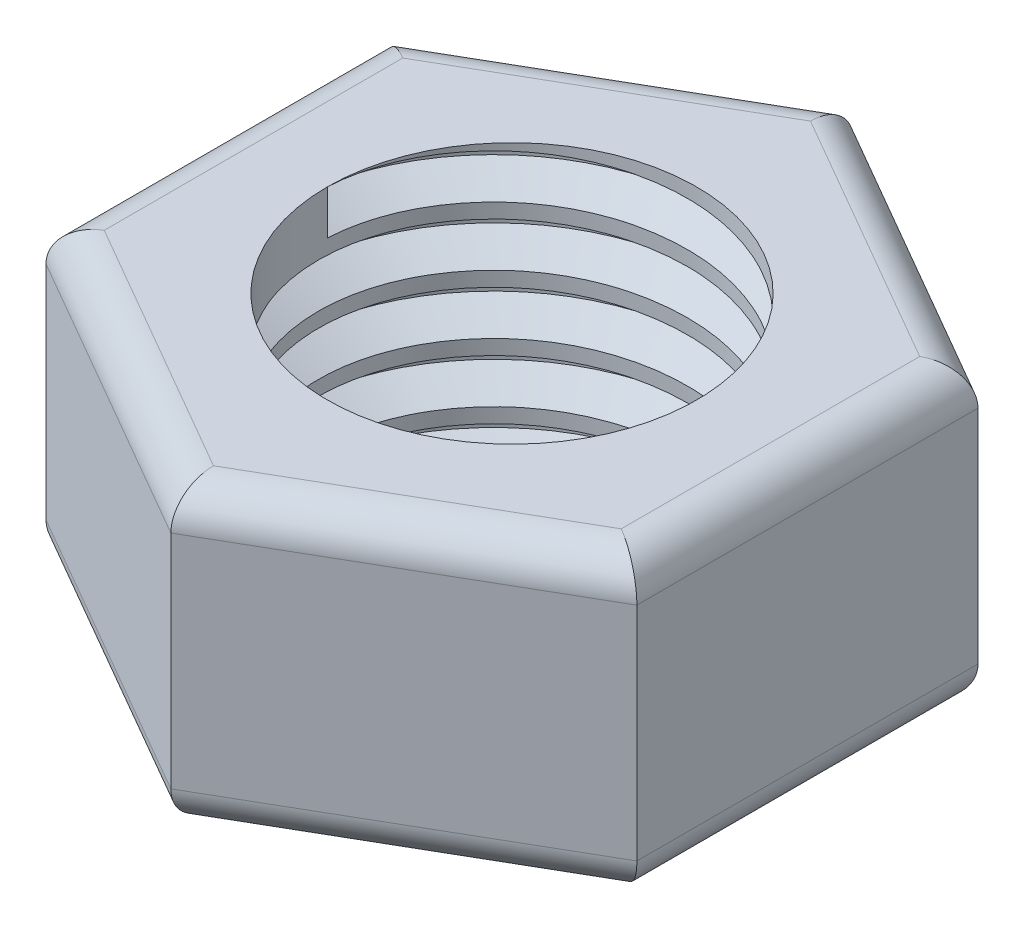
from build123d import *

# Parameters (mm, degrees)
SKETCH1_R           = 2.5
BOSS_EXTRUDE1_DEPTH = 4
THREAD1_PITCH       = 0.8
FILLET1_R           = 0.5


with BuildPart() as part:
    # Sketch1 → Boss-Extrude1 (new body)
    with BuildSketch(Plane(origin=(0, 0, 0), x_dir=(1, 0, 0), z_dir=(0, 1, 0))):
        Polygon((0, 4.618802154), (-4, 2.309401077), (-4, -2.309401077), (0, -4.618802154), (4, -2.309401077), (4, 2.309401077), align=None)
        with Locations(Location((0, 0, 0), (0, 0, 270))):
            Circle(SKETCH1_R, mode=Mode.SUBTRACT)
    extrude(amount=BOSS_EXTRUDE1_DEPTH)

    # Thread1: the profile of Thread Profile1 profile screwed along a right-hand helix of 5 turns, 8 arcs to a turn; built about Z, then put on its axis
    thread1_z = Axis((0, 0, 0), (0, 0, 1))
    thread1_corners = [(2.4997, 0, -0.000173205), (2.9330127, 0, 0.249999999), (2.9330127, 0, 0.349999999), (2.4997, 0, 0.600173203)]
    with BuildLine(mode=Mode.PRIVATE) as thread1_profile:
        Line(thread1_corners[0], thread1_corners[1])
        Line(thread1_corners[1], thread1_corners[2])
        Line(thread1_corners[2], thread1_corners[3])
        Line(thread1_corners[3], thread1_corners[0])
    thread1_cap = Face(thread1_profile.wire())
    thread1_turn_angles = [0, 22.5, 45, 67.5, 90, 112.5, 135, 157.5, 180, 202.5, 225, 247.5, 270, 292.5, 315, 337.5, 360]
    thread1_turn_weights = [1, 0.9238795325112867, 1, 0.9238795325112867, 1, 0.9238795325112867, 1, 0.9238795325112867, 1, 0.9238795325112867, 1, 0.9238795325112867, 1, 0.9238795325112867, 1, 0.9238795325112867, 1]
    thread1_turn_rails = [Edge.make_bspline([Vector(p[0], p[1], 0).rotate(thread1_z, thread1_turn_angles[k]) / thread1_turn_weights[k] + Vector(0, 0, p[2] + THREAD1_PITCH * thread1_turn_angles[k] / 360) for k in range(17)], [0, 0, 0, 1, 1, 2, 2, 3, 3, 4, 4, 5, 5, 6, 6, 7, 7, 8, 8, 8], 2, thread1_turn_weights) for p in thread1_corners]
    thread1_turn_sides = [Face.make_surface_from_curves(thread1_turn_rails[p[0]], thread1_turn_rails[p[1]]) for p in [(0, 1), (1, 2), (2, 3), (3, 0)]]
    thread1 = Plane(origin=(0, 4, 0), x_dir=(-1, 0, 0), z_dir=(0, -1, 0)) * Solid(Shell([*[p.moved(Location((0, 0, THREAD1_PITCH * i))) for i in range(5) for p in thread1_turn_sides], thread1_cap, thread1_cap.rotate(thread1_z, 1800).moved(Location((0, 0, THREAD1_PITCH * 1800 / 360)))]))
    add(thread1, mode=Mode.SUBTRACT)

    # Fillet1
    fillet1_edges = [part.edges().sort_by_distance(p)[0] for p in [
        (-4, 4, 0),
        (-2, 4, 3.464101615),
        (2, 4, 3.464101615),
        (4, 4, 0),
        (2, 4, -3.464101615),
        (4, 0, 0),
        (2, 0, 3.464101615),
        (-2, 0, 3.464101615),
        (-4, 0, 0),
        (-2, 0, -3.464101615),
        (2, 0, -3.464101615),
        (-2, 4, -3.464101615),
    ]]
    fillet(fillet1_edges, radius=FILLET1_R)


solid = part.part
